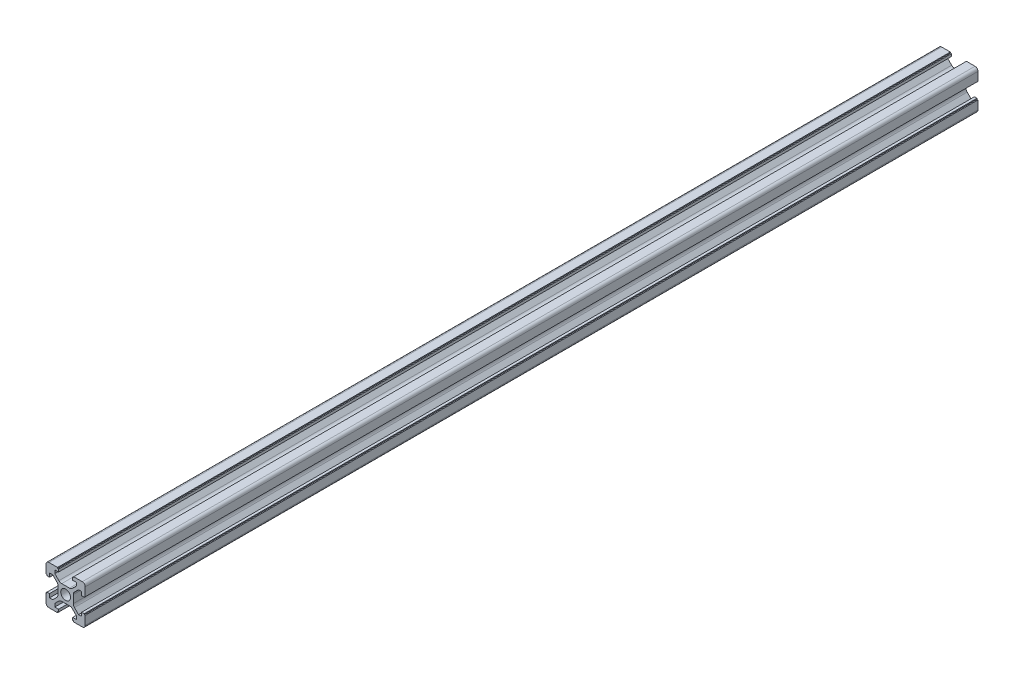
from build123d import *

# Parameters (mm, degrees)
SKETCH1_R           = 2.5
BOSS_EXTRUDE2_DEPTH = 455


with BuildPart() as part:
    # Sketch1 → Boss-Extrude2 (new body)
    with BuildSketch(Plane.XY):
        with BuildLine():
            Line((10, -8.5), (10, -4.1))
            Line((10, -4.1), (9.5, -4.1))
            Line((9.5, -4.1), (9.5, -3.6))
            Line((9.5, -3.6), (8.2, -3.6))
            Line((8.2, -3.6), (8.2, -5.5))
            Line((8.2, -5.5), (6.560660172, -5.5))
            Line((6.560660172, -5.5), (4.485786438, -3.425126266))
            ThreePointArc((4.485786438, -3.425126266), (4.052240935, -2.776279568), (3.9, -2.010912703))
            Line((3.9, -2.010912703), (3.9, 2.010912703))
            ThreePointArc((3.9, 2.010912703), (4.052240935, 2.776279568), (4.485786438, 3.425126266))
            Line((4.485786438, 3.425126266), (6.560660172, 5.5))
            Line((6.560660172, 5.5), (8.2, 5.5))
            Line((8.2, 5.5), (8.2, 3.6))
            Line((8.2, 3.6), (9.5, 3.6))
            Line((9.5, 3.6), (9.5, 4.1))
            Line((9.5, 4.1), (10, 4.1))
            Line((10, 4.1), (10, 8.5))
            ThreePointArc((10, 8.5), (9.560660172, 9.560660172), (8.5, 10))
            Line((8.5, 10), (4.1, 10))
            Line((4.1, 10), (4.1, 9.5))
            Line((4.1, 9.5), (3.6, 9.5))
            Line((3.6, 9.5), (3.6, 8.2))
            Line((3.6, 8.2), (5.5, 8.2))
            Line((5.5, 8.2), (5.5, 6.560660172))
            Line((5.5, 6.560660172), (3.425126266, 4.485786438))
            ThreePointArc((3.425126266, 4.485786438), (2.776279568, 4.052240935), (2.010912703, 3.9))
            Line((2.010912703, 3.9), (-2.010912703, 3.9))
            ThreePointArc((-2.010912703, 3.9), (-2.776279568, 4.052240935), (-3.425126266, 4.485786438))
            Line((-3.425126266, 4.485786438), (-5.5, 6.560660172))
            Line((-5.5, 6.560660172), (-5.5, 8.2))
            Line((-5.5, 8.2), (-3.6, 8.2))
            Line((-3.6, 8.2), (-3.6, 9.5))
            Line((-3.6, 9.5), (-4.1, 9.5))
            Line((-4.1, 9.5), (-4.1, 10))
            Line((-4.1, 10), (-8.5, 10))
            ThreePointArc((-8.5, 10), (-9.560660172, 9.560660172), (-10, 8.5))
            Line((-10, 8.5), (-10, 4.1))
            Line((-10, 4.1), (-9.5, 4.1))
            Line((-9.5, 4.1), (-9.5, 3.6))
            Line((-9.5, 3.6), (-8.2, 3.6))
            Line((-8.2, 3.6), (-8.2, 5.5))
            Line((-8.2, 5.5), (-6.560660172, 5.5))
            Line((-6.560660172, 5.5), (-4.485786438, 3.425126266))
            ThreePointArc((-4.485786438, 3.425126266), (-4.052240935, 2.776279568), (-3.9, 2.010912703))
            Line((-3.9, 2.010912703), (-3.9, -2.010912703))
            ThreePointArc((-3.9, -2.010912703), (-4.052240935, -2.776279568), (-4.485786438, -3.425126266))
            Line((-4.485786438, -3.425126266), (-6.560660172, -5.5))
            Line((-6.560660172, -5.5), (-8.2, -5.5))
            Line((-8.2, -5.5), (-8.2, -3.6))
            Line((-8.2, -3.6), (-9.5, -3.6))
            Line((-9.5, -3.6), (-9.5, -4.1))
            Line((-9.5, -4.1), (-10, -4.1))
            Line((-10, -4.1), (-10, -8.5))
            ThreePointArc((-10, -8.5), (-9.560660172, -9.560660172), (-8.5, -10))
            Line((-8.5, -10), (-4.1, -10))
            Line((-4.1, -10), (-4.1, -9.5))
            Line((-4.1, -9.5), (-3.6, -9.5))
            Line((-3.6, -9.5), (-3.6, -8.2))
            Line((-3.6, -8.2), (-5.5, -8.2))
            Line((-5.5, -8.2), (-5.5, -6.560660172))
            Line((-5.5, -6.560660172), (-3.425126266, -4.485786438))
            ThreePointArc((-3.425126266, -4.485786438), (-2.776279568, -4.052240935), (-2.010912703, -3.9))
            Line((-2.010912703, -3.9), (2.010912703, -3.9))
            ThreePointArc((2.010912703, -3.9), (2.776279568, -4.052240935), (3.425126266, -4.485786438))
            Line((3.425126266, -4.485786438), (5.5, -6.560660172))
            Line((5.5, -6.560660172), (5.5, -8.2))
            Line((5.5, -8.2), (3.6, -8.2))
            Line((3.6, -8.2), (3.6, -9.5))
            Line((3.6, -9.5), (4.1, -9.5))
            Line((4.1, -9.5), (4.1, -10))
            Line((4.1, -10), (8.5, -10))
            ThreePointArc((8.5, -10), (9.560660172, -9.560660172), (10, -8.5))
        make_face()
        Circle(SKETCH1_R, mode=Mode.SUBTRACT)
    extrude(amount=BOSS_EXTRUDE2_DEPTH)


solid = part.part
